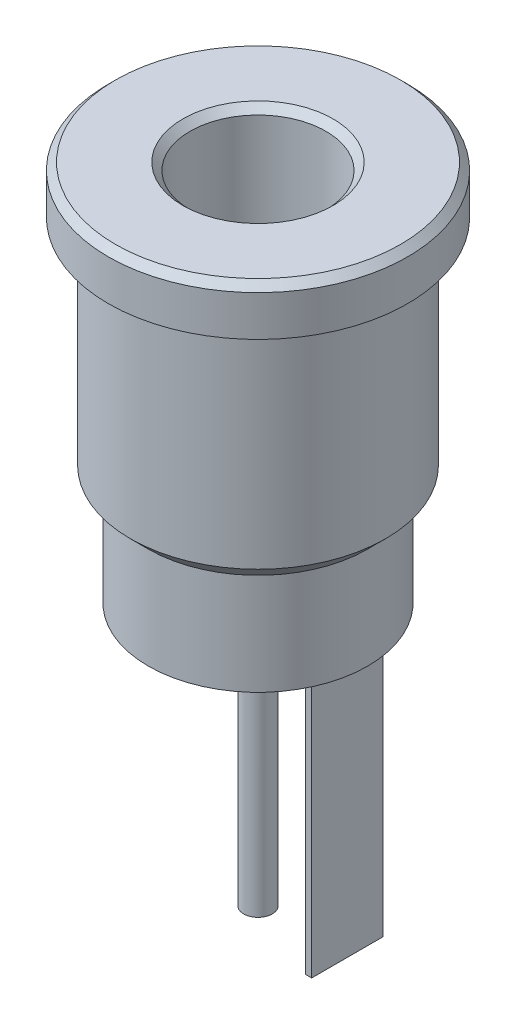
from build123d import *

# Parameters (mm, degrees)
SKETCH1_R           = 5.35
BOSS_EXTRUDE1_DEPTH = 14
SKETCH2_R           = 6.275
BOSS_EXTRUDE2_DEPTH = 2
SKETCH3_R           = 2.85
CUT_EXTRUDE1_DEPTH  = 11.9
SKETCH4_R           = 1
BOSS_EXTRUDE3_DEPTH = 8.9
FILLET1_R           = 1
CHAMFER1_SIZE       = 0.3
SKETCH5_R           = 5.35
SKETCH5_R_2         = 4.6
CUT_EXTRUDE2_DEPTH  = 4
CHAMFER2_SIZE       = 1
SKETCH6_R           = 0.6
SKETCH6_W           = 0.25
SKETCH6_H           = 3
BOSS_EXTRUDE4_DEPTH = 11


with BuildPart() as part:
    # Sketch1 → Boss-Extrude1 (new body)
    with BuildSketch(Plane(origin=(0, 0, 0), x_dir=(1, 0, 0), z_dir=(0, 1, 0))):
        with Locations(Location((0, 0, 0), (0, 0, 270))):
            Circle(SKETCH1_R)
    extrude(amount=BOSS_EXTRUDE1_DEPTH)

    # Sketch2 → Boss-Extrude2 (add)
    with BuildSketch(Plane(origin=(0, 14, 0), x_dir=(1, 0, 0), z_dir=(0, 1, 0))):
        with Locations(Location((0, 0, 0), (0, 0, 270))):
            Circle(SKETCH2_R)
    extrude(amount=BOSS_EXTRUDE2_DEPTH)

    # Sketch3 → Cut-Extrude1 (cut)
    with BuildSketch(Plane(origin=(0, 16, 0), x_dir=(1, 0, 0), z_dir=(0, 1, 0))):
        with Locations(Location((0, 0, 0), (0, 0, 270))):
            Circle(SKETCH3_R)
    extrude(amount=-CUT_EXTRUDE1_DEPTH, mode=Mode.SUBTRACT)

    # Sketch4 → Boss-Extrude3 (add)
    with BuildSketch(Plane(origin=(0, 4.1, 0), x_dir=(1, 0, 0), z_dir=(0, 1, 0))):
        with Locations(Location((0, 0, 0), (0, 0, 270))):
            Circle(SKETCH4_R)
    extrude(amount=BOSS_EXTRUDE3_DEPTH)

    # Fillet1
    fillet1_edges = [part.edges().sort_by_distance(p)[0] for p in [
        (0, 13, -1),
    ]]
    fillet(fillet1_edges, radius=FILLET1_R)

    # Chamfer1
    chamfer1_edges = [part.edges().sort_by_distance(p)[0] for p in [
        (0, 16, -2.85),
        (0, 16, -6.275),
    ]]
    chamfer(chamfer1_edges, length=CHAMFER1_SIZE)

    # Sketch5 → Cut-Extrude2 (cut)
    with BuildSketch(Plane.XZ):
        with Locations(Location((0, 0, 0), (0, 0, 270))):
            Circle(SKETCH5_R)
        with Locations(Location((0, 0, 0), (0, 0, 270))):
            Circle(SKETCH5_R_2, mode=Mode.SUBTRACT)
    extrude(amount=-CUT_EXTRUDE2_DEPTH, mode=Mode.SUBTRACT)

    # Chamfer2
    # the kernel refuses this chamfer: 1 mm, written as the material it takes off along each edge
    with BuildSketch(Plane(origin=(0, 4, 0), x_dir=(0, 0, 1), z_dir=(-1, 0, 0))) as chamfer2_piece_1_section:
        Polygon((5.35, CHAMFER2_SIZE), (5.35 - CHAMFER2_SIZE, 0), (5.35, 0), align=None)
    chamfer2_piece_1 = revolve(axis=Axis((0, 4, 0), (0, 1, 0)), mode=Mode.PRIVATE)
    chamfer2_piece_1 = chamfer2_piece_1 - Plane(origin=(0, 4.621256609, 0), x_dir=(0, 0, -1), z_dir=(0, -1, 0)) * Cylinder(4.6, 22, mode=Mode.PRIVATE)
    add(chamfer2_piece_1, mode=Mode.SUBTRACT)

    # Sketch6 → Boss-Extrude4 (add)
    with BuildSketch(Plane.XZ):
        with Locations(Location((0, 0, 0), (0, 0, 90))):
            Circle(SKETCH6_R)
        with Locations((3.625, 0)):
            Rectangle(SKETCH6_W, SKETCH6_H)
    extrude(amount=BOSS_EXTRUDE4_DEPTH)


solid = part.part
